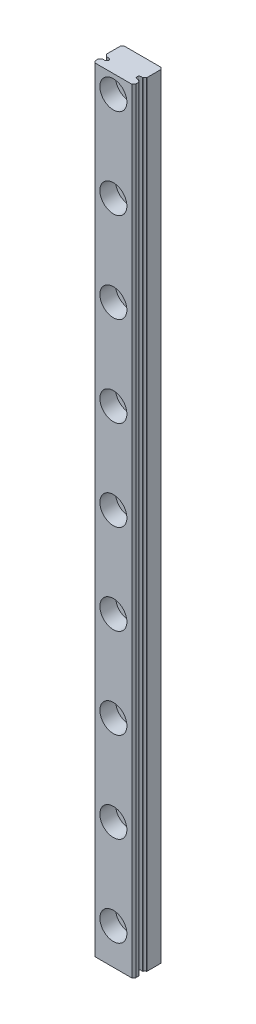
from build123d import *

# Parameters (mm, degrees)
RESSALTO_EXTRUS_O1_DEPTH                             = 1000
CORTE_EXTRUS_O1_START                                = -1000
CORTE_EXTRUS_O1_DEPTH                                = 1000
CORTE_EXTRUS_O2_DEPTH                                = 1001.031261626
CORTE_EXTRUS_O3_DEPTH                                = 1001.031261626
CORTE_EXTRUS_O4_DEPTH                                = 1001.031261626
CORTE_EXTRUS_O5_DEPTH                                = 0.002166667
CORTE_EXTRUS_O6_DEPTH                                = 0.002166667
CORTE_EXTRUS_O7_DEPTH                                = 0.002166667
CORTE_EXTRUS_O8_DEPTH                                = 0.002166667
INCLINA_O1_ANGLE                                     = 45.1469538
ESBO_O10_W                                           = 0.450000001
ESBO_O10_H                                           = 1000
REBAIXO_PARA_PARAFUSO_DE_M_QUINA_DE_CABE_D           = 3.5
REBAIXO_PARA_PARAFUSO_DE_M_QUINA_DE_CABE_CBORE_D     = 6
REBAIXO_PARA_PARAFUSO_DE_M_QUINA_DE_CABE_CBORE_DEPTH = 3.50000002
CHANFRO1_SIZE                                        = 0.062563219
CHANFRO1_SIZE2                                       = 0.062205617
CHANFRO3_START                                       = -3.730761794
CHANFRO3_DEPTH                                       = 0.399013115
CHANFRO4_SIZE                                        = 0.4
FILETE1_R                                            = 0.130000023
SKETCH1_W                                            = 36.072768502
SKETCH1_H                                            = 659.552877555
SKETCH1_W_2                                          = 21.632087489
SKETCH1_H_2                                          = 215.829832124
CUT_EXTRUDE1_DEPTH                                   = 10


with BuildPart() as part:
    # Esboço1 → Ressalto-extrusão1 (new body)
    with BuildSketch(Plane.XZ):
        with BuildLine():
            Line((4.5, 5.4097155), (4.5, 6.01167813))
            Line((4.5, 6.01167813), (4.1, 6.50000002))
            Line((4.1, 6.50000002), (-4.1, 6.50000002))
            Line((-4.1, 6.50000002), (-4.5, 6.01167813))
            Line((-4.5, 6.01167813), (-4.5, 2e-08))
            Line((-4.5, 2e-08), (4.5, 2e-08))
            Line((4.5, 2e-08), (4.5, 3.50196265))
            ThreePointArc((4.5, 3.50196265), (4.477413879, 3.553810372), (4.43494978, 3.59116167))
            ThreePointArc((4.43494978, 3.59116167), (3.930462682, 4.43021964), (4.43494978, 5.26927761))
            ThreePointArc((4.43494978, 5.26927761), (4.490651601, 5.328761203), (4.5, 5.4097155))
        make_face()
    extrude(amount=-RESSALTO_EXTRUS_O1_DEPTH)

    # Esboço2 → Corte-extrusão1 (cut)
    with BuildSketch(Plane(origin=(0, 1000, 0), x_dir=(-1, 0, 0), z_dir=(0, 1, 0)).offset(CORTE_EXTRUS_O1_START)):
        with BuildLine():
            Line((-4.030498711, 4.00588336), (-3.673447948, 4.00588336))
            ThreePointArc((-3.673447948, 4.00588336), (-3.223447946, 4.455883362), (-3.673447948, 4.905883363))
            Line((-3.673447948, 4.905883363), (-3.953580008, 4.905883363))
            ThreePointArc((-3.953580008, 4.905883363), (-4.010719931, 4.899199784), (-4.065149208, 4.917830263))
            ThreePointArc((-4.065149208, 4.917830263), (-3.93114763, 4.466290066), (-4.030498711, 4.00588336))
        make_face()
    extrude(amount=CORTE_EXTRUS_O1_DEPTH, mode=Mode.SUBTRACT)

    # Esboço3 → Corte-extrusão2 (cut, through all)
    with BuildSketch(Plane(origin=(0, 1000, 0), x_dir=(-1, 0, 0), z_dir=(0, 1, 0))):
        with BuildLine():
            Line((4.5, 4.03150278), (4.5, 4.88017535))
            Line((4.5, 4.88017535), (3.66946318, 4.88017535))
            ThreePointArc((3.66946318, 4.88017535), (3.969667593, 4.455839065), (3.66946318, 4.03150278))
            Line((3.66946318, 4.03150278), (4.5, 4.03150278))
        make_face()
    extrude(amount=-CORTE_EXTRUS_O2_DEPTH, mode=Mode.SUBTRACT)

    # Esboço4 → Corte-extrusão3 (cut, through all)
    with BuildSketch(Plane(origin=(0, 1000, 0), x_dir=(-1, 0, 0), z_dir=(0, 1, 0))):
        with BuildLine():
            Line((4.026513974, 4.88017535), (4.5, 4.88017535))
            Line((4.5, 4.88017535), (4.5, 5.328056964))
            ThreePointArc((4.5, 5.328056964), (4.223646078, 5.145991535), (4.026513974, 4.88017535))
        make_face()
    extrude(amount=-CORTE_EXTRUS_O3_DEPTH, mode=Mode.SUBTRACT)

    # Esboço5 → Corte-extrusão4 (cut, through all)
    with BuildSketch(Plane(origin=(0, 1000, 0), x_dir=(-1, 0, 0), z_dir=(0, 1, 0))):
        with BuildLine():
            Line((4.5, 3.583620931), (4.5, 4.03150278))
            Line((4.5, 4.03150278), (4.026513856, 4.03150278))
            ThreePointArc((4.026513856, 4.03150278), (4.223645982, 3.76568645), (4.5, 3.583620931))
        make_face()
    extrude(amount=-CORTE_EXTRUS_O4_DEPTH, mode=Mode.SUBTRACT)

    # Esboço6 → Corte-extrusão5 (cut)
    with BuildSketch(Plane(origin=(0, 1000, 0), x_dir=(-1, 0, 0), z_dir=(0, 1, 0))):
        Polygon((0.891369267, 3.403698133), (0.714701433, 3.168235633), (0.2187042, 2.61105), (1.0945792, 2.61105), (1.0945792, 2.695983333), (0.398689633, 2.695983333), (0.794326433, 3.149466667), (0.9743123, 3.3891), (1.067110588, 3.573407857), (0.95413722, 3.802321701), (0.7876908, 3.88505), (0.54301, 3.88505), (0.375434678, 3.803592619), (0.295011167, 3.6384023), (0.295011167, 3.562), (0.3812718, 3.562), (0.3812718, 3.631766667), (0.437672733, 3.743620833), (0.549645633, 3.800116667), (0.7802262, 3.800116667), (0.893028067, 3.743810633), (0.976240026, 3.576039029), align=None)
    extrude(amount=-CORTE_EXTRUS_O5_DEPTH, mode=Mode.SUBTRACT)

    # Esboço7 → Corte-extrusão6 (cut)
    with BuildSketch(Plane.XZ):
        Polygon((-0.214632167, 3.88505), (-0.953983333, 3.88505), (-0.953983333, 2.61105), (-0.214632167, 2.61105), (-0.214632167, 2.695983333), (-0.86905, 2.695983333), (-0.86905, 3.205583333), (-0.5123963, 3.205583333), (-0.5123963, 3.290516667), (-0.86905, 3.290516667), (-0.86905, 3.800116667), (-0.214632167, 3.800116667), align=None)
    extrude(amount=-CORTE_EXTRUS_O6_DEPTH, mode=Mode.SUBTRACT)

    # Esboço8 → Corte-extrusão7 (cut)
    with BuildSketch(Plane(origin=(0, 1000, 0), x_dir=(-1, 0, 0), z_dir=(0, 1, 0))):
        Polygon((-0.214632167, 3.88505), (-0.953983333, 3.88505), (-0.953983333, 2.61105), (-0.214632167, 2.61105), (-0.214632167, 2.695983333), (-0.86905, 2.695983333), (-0.86905, 3.205583333), (-0.5123963, 3.205583333), (-0.5123963, 3.290516667), (-0.86905, 3.290516667), (-0.86905, 3.800116667), (-0.214632167, 3.800116667), align=None)
    extrude(amount=-CORTE_EXTRUS_O7_DEPTH, mode=Mode.SUBTRACT)

    # Esboço9 → Corte-extrusão8 (cut)
    with BuildSketch(Plane.XZ):
        Polygon((0.510057167, 3.620830633), (0.6071, 3.718655633), (0.6071, 2.609403333), (0.692033333, 2.609403333), (0.692033333, 3.883403333), (0.6741176, 3.883403333), (0.6741176, 3.795069794), (0.3690544, 3.640736667), (0.3690544, 3.551253333), align=None)
    extrude(amount=-CORTE_EXTRUS_O8_DEPTH, mode=Mode.SUBTRACT)

    # Inclinação1
    inclina_o1_faces = [part.faces().sort_by_distance(p)[0] for p in [
        (0.6741176, 0.001083333, 3.839236564),
    ]]
    draft(inclina_o1_faces, Plane(origin=(0.692033333, 0.002166667, 3.883403333), x_dir=(-1, 0, 0), z_dir=(0, 0, -1)), INCLINA_O1_ANGLE)

    # Esboço10 → Corte-Revolução1 (revolve, cut)
    with BuildSketch(Plane.XY.offset(4.455839065)):
        with Locations((-3.294667591, 500)):
            Rectangle(ESBO_O10_W, ESBO_O10_H)
    revolve(axis=Axis((-3.519667591, 1000, 4.455839065), (0, -1, 0)), mode=Mode.SUBTRACT)

    # Rebaixo para parafuso de máquina de cabeça sextavada de M31 (through all)
    with Locations(Plane.XY.offset(6.50000002)):
        with Locations((0, 990), (0, 970), (0, 950), (0, 930), (0, 910), (0, 890), (0, 870), (0, 850), (0, 830), (0, 810), (0, 790), (0, 770), (0, 750), (0, 730), (0, 710), (0, 690), (0, 670), (0, 650), (0, 630), (0, 610), (0, 590), (0, 570), (0, 550), (0, 530), (0, 510), (0, 490), (0, 470), (0, 450), (0, 430), (0, 410), (0, 390), (0, 370), (0, 350), (0, 330), (0, 310), (0, 290), (0, 270), (0, 250), (0, 230), (0, 210), (0, 190), (0, 170), (0, 150), (0, 130), (0, 110), (0, 90), (0, 70), (0, 50), (0, 30), (0, 10)):
            CounterBoreHole(REBAIXO_PARA_PARAFUSO_DE_M_QUINA_DE_CABE_D / 2, REBAIXO_PARA_PARAFUSO_DE_M_QUINA_DE_CABE_CBORE_D / 2, REBAIXO_PARA_PARAFUSO_DE_M_QUINA_DE_CABE_CBORE_DEPTH)

    # Chanfro1
    chanfro1_edges = [part.edges().sort_by_distance(p)[0] for p in [
        (-0.976240026, 999.998916667, 3.576039029),
    ]]
    chanfro1_side = [part.faces().sort_by_distance(p)[0] for p in [
        (-0.933804646, 999.998916667, 3.489868581),
    ]]
    chamfer(chanfro1_edges, length=CHANFRO1_SIZE, length2=CHANFRO1_SIZE2, reference=chanfro1_side[0])

    # Chanfro3: read off the stored shape, not the designer's step
    # Chanfro3 outline → Chanfro3 (add)
    with BuildSketch(Plane(origin=(0, 0, 0), x_dir=(0.8991051825477068, 0, 0.43773264753254887), z_dir=(0.4377326475325489, 0, -0.8991051825477069)).offset(CHANFRO3_START)):
        Polygon((1.327401403, -999.997833333), (1.31122788, -999.997833333), (1.311999664, -1000), (1.327401403, -1000), align=None)
    extrude(amount=CHANFRO3_DEPTH)

    # Chanfro4
    chanfro4_edges = [part.edges().sort_by_distance(p)[0] for p in [
        (4.5, 500, 2e-08),
        (-4.5, 500, 2e-08),
    ]]
    chamfer(chanfro4_edges, length=CHANFRO4_SIZE)

    # Filete1
    filete1_edges = [part.edges().sort_by_distance(p)[0] for p in [
        (4.030498711, 500, 4.00588336),
        (-4.026513974, 500, 4.88017535),
        (-4.5, 500, 5.328056964),
        (-4.5, 500, 3.583620931),
        (-4.026513856, 500, 4.03150278),
    ]]
    fillet(filete1_edges, radius=FILETE1_R)

    # Sketch1 → Cut-Extrude1 (cut)
    with BuildSketch(Plane(origin=(0, 0, 0), x_dir=(-1, 0, 0), z_dir=(0, 0, -1))):
        with Locations((-9.39117436, 683.776438778)):
            Rectangle(SKETCH1_W, SKETCH1_H)
        with Locations((0.25600221, 74.108809522)):
            Rectangle(SKETCH1_W_2, SKETCH1_H_2)
    extrude(amount=-CUT_EXTRUDE1_DEPTH, mode=Mode.SUBTRACT)


solid = part.part
